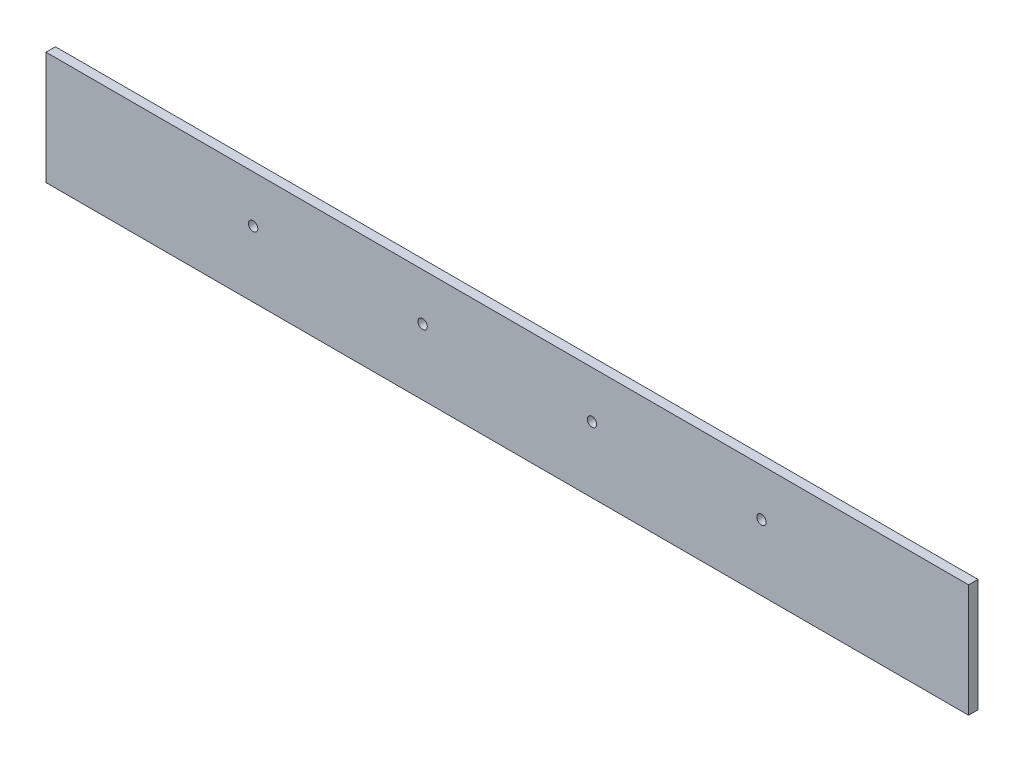
from build123d import *

# Parameters (mm, degrees)
SKETCH1_W                   = 622.3
SKETCH1_H                   = 76.2
BOSS_EXTRUDE1_DEPTH         = 6.35
F_1_4_0_25_DIAMETER_HOLE1_D = 6.35
LPATTERN1_COUNT             = 4
LPATTERN1_PITCH             = 114.3


with BuildPart() as part:
    # Sketch1 → Boss-Extrude1 (new body)
    with BuildSketch(Plane.XY.offset(457.2)):
        with Locations((0, 571.5)):
            Rectangle(SKETCH1_W, SKETCH1_H)
    extrude(amount=BOSS_EXTRUDE1_DEPTH)

    # 1/4 (0.25) Diameter Hole1 (through all)
    with Locations(Plane.XY.offset(463.55)):
        with Locations((171.45, 577.85)):
            f_1_4_0_25_diameter_hole1 = Hole(F_1_4_0_25_DIAMETER_HOLE1_D / 2)

    # LPattern1: 1/4 (0.25) Diameter Hole1 ×4
    with Locations(*[(-i * LPATTERN1_PITCH, 0, 0) for i in range(1, LPATTERN1_COUNT)]):
        add(f_1_4_0_25_diameter_hole1, mode=Mode.SUBTRACT)


solid = part.part
